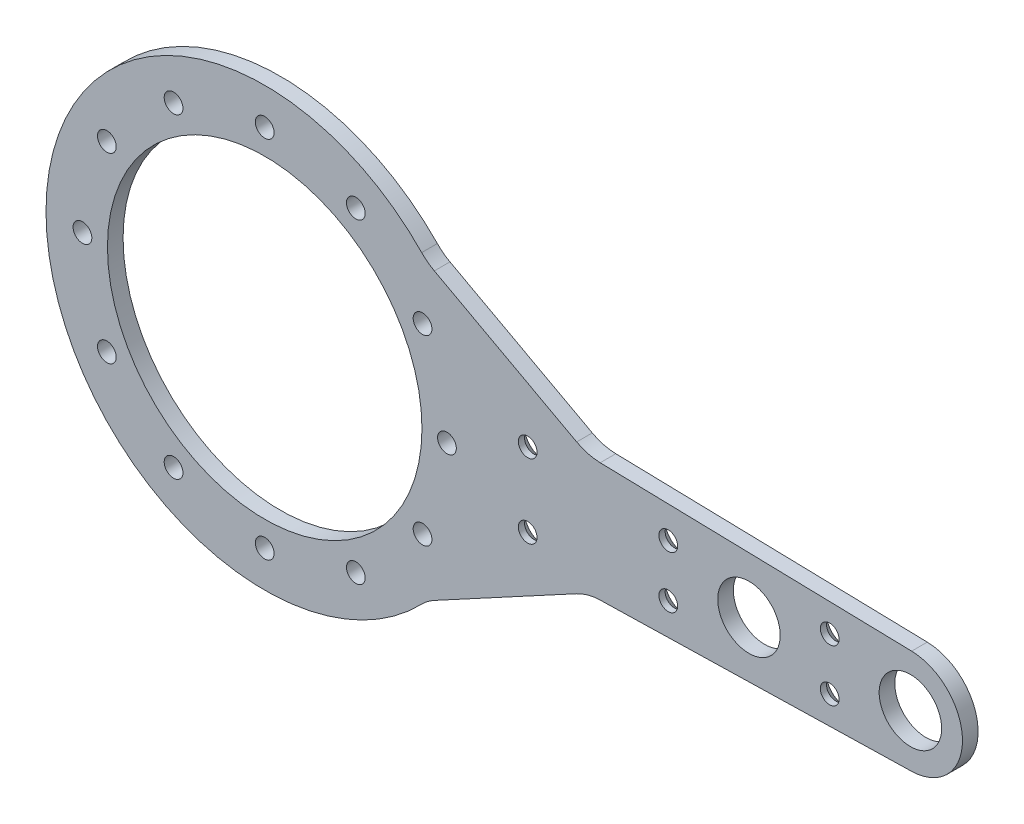
from build123d import *

# Parameters (mm, degrees)
SKETCH1_R                  = 15.1
SKETCH1_R_2                = 3
BOSS_EXTRUDE1_DEPTH        = 1.5
M1_6_CLEARANCE_HOLE2_D     = 1.8
M1_6_CLEARANCE_HOLE2_DEPTH = 11.5
CIRPATTERN1_COUNT          = 12
M1_6_CLEARANCE_HOLE1_D     = 1.8
M1_6_CLEARANCE_HOLE1_DEPTH = 11.5
CHAMFER2_SIZE              = 10.890667049
FILLET4_R                  = 5
CHAMFER3_SIZE              = 0.9
ESQUISSE1_R                = 0.9
ENL_V_MAT_EXTRU_1_DEPTH    = 71.229979354
CHANFREIN1_SIZE            = 0.9


with BuildPart() as part:
    # Sketch1 → Boss-Extrude1 (new body)
    with BuildSketch(Plane.XY):
        with BuildLine():
            Line((20.124611797, 6), (62.119198271, 4.998578975))
            ThreePointArc((62.119198271, 4.998578975), (67, 0), (62.119198271, -4.998578975))
            Line((62.119198271, -4.998578975), (20.124611797, -6))
            ThreePointArc((20.124611797, -6), (-21, 0), (20.124611797, 6))
        make_face()
        Circle(SKETCH1_R, mode=Mode.SUBTRACT)
        with Locations((46.5, 0)):
            Circle(SKETCH1_R_2, mode=Mode.SUBTRACT)
        with Locations((62, 0)):
            Circle(SKETCH1_R_2, mode=Mode.SUBTRACT)
    extrude(amount=BOSS_EXTRUDE1_DEPTH)

    # M1.6 Clearance Hole2
    with Locations(Plane.XY.offset(1.5)):
        with Locations((0, 17.5)):
            m1_6_clearance_hole2 = Hole(M1_6_CLEARANCE_HOLE2_D / 2, depth=M1_6_CLEARANCE_HOLE2_DEPTH)

    # CirPattern1: M1.6 Clearance Hole2 ×12 about axis
    cirpattern1_axis = Axis((0, 0, 0), (0, 0, 1))
    for i in range(1, CIRPATTERN1_COUNT):
        add(m1_6_clearance_hole2.rotate(cirpattern1_axis, i * 360 / CIRPATTERN1_COUNT), mode=Mode.SUBTRACT)

    # M1.6 Clearance Hole1
    with Locations(Plane.XY.offset(1.5)):
        with Locations((38.75, 2.5), (54.25, -2.5), (38.75, -2.5), (54.25, 2.5)):
            Hole(M1_6_CLEARANCE_HOLE1_D / 2, depth=M1_6_CLEARANCE_HOLE1_DEPTH)

    # Chamfer2
    # the kernel refuses this chamfer: 10.890667049, 7 mm, written as the material it adds along each edge
    with BuildSketch(Plane(origin=(20.124611797, -6, 0), x_dir=(-0.49038575496704445, -0.8715054855394783, 0), z_dir=(0, 0, 1))) as chamfer2_piece_1:
        with BuildLine():
            Line((9.279580073, 0), (-CHAMFER2_SIZE * 0.511022774248, CHAMFER2_SIZE * 0.85956717261))
            Line((-CHAMFER2_SIZE * 0.511022774248, CHAMFER2_SIZE * 0.85956717261), (0, 0))
            ThreePointArc((0, 0), (4.8297685, 0.518116548), (9.279580073, 0))
        make_face()
    extrude(amount=1.5)
    with BuildSketch(Plane(origin=(20.124611797, 6, 0), x_dir=(0.9997157950597969, -0.023839654107353114, 0), z_dir=(0, 0, 1))) as chamfer2_piece_2:
        with BuildLine():
            Line((CHAMFER2_SIZE, 0), (-4.742076753, 7.976422406))
            ThreePointArc((-4.742076753, 7.976422406), (-2.022765722, 4.41627981), (0, 0))
            Line((0, 0), (CHAMFER2_SIZE, 0))
        make_face()
    extrude(amount=1.5)

    # Fillet4
    fillet4_edges = [part.edges().sort_by_distance(p)[0] for p in [
        (31.012183665, -5.740370265, 0.75),
        (15.574037918, 14.087204937, 0.75),
        (15.574037918, -14.087204937, 0.75),
        (31.012183665, 5.740370265, 0.75),
    ]]
    fillet(fillet4_edges, radius=FILLET4_R)

    # Chamfer3
    chamfer3_edges = [part.edges().sort_by_distance(p)[0] for p in [
        (39.65, 2.5, 0),
        (55.15, 2.5, 0),
        (39.65, -2.5, 0),
        (55.15, -2.5, 0),
    ]]
    chamfer(chamfer3_edges, length=CHAMFER3_SIZE)

    # Esquisse1 → Enlèv. mat.-Extru.1 (cut, through all)
    with BuildSketch(Plane(origin=(0, 0, 0), x_dir=(-1, 0, 0), z_dir=(0, 0, -1))):
        with Locations((-25.251835753, 3.548914074)):
            Circle(ESQUISSE1_R)
        with Locations((-25.251835753, -3.548914074)):
            Circle(ESQUISSE1_R)
    extrude(amount=-ENL_V_MAT_EXTRU_1_DEPTH, mode=Mode.SUBTRACT)

    # Chanfrein1
    chanfrein1_edges = [part.edges().sort_by_distance(p)[0] for p in [
        (26.151835753, 3.548914074, 0),
        (26.151835753, -3.548914074, 0),
    ]]
    chamfer(chanfrein1_edges, length=CHANFREIN1_SIZE)


solid = part.part
